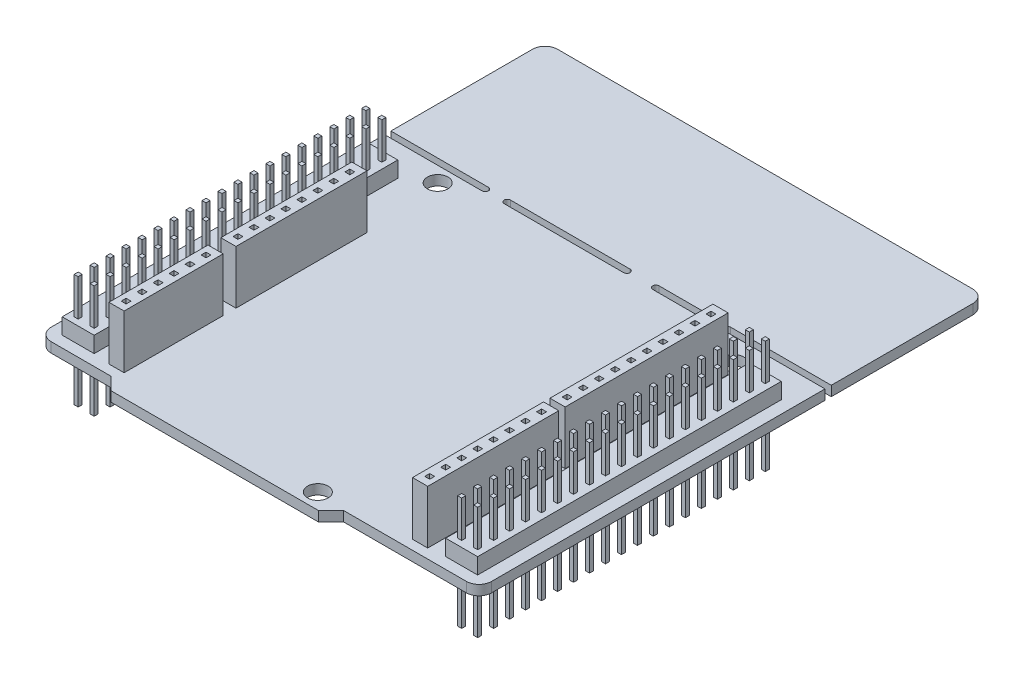
from build123d import *

# Parameters (mm, degrees)
BOSS_EXTRUDE1_DEPTH  = 0.79008
SKETCH2_W            = 5.08
SKETCH2_H            = 48.26
BOSS_EXTRUDE2_DEPTH  = 2.52984
BOSS_EXTRUDE3_START  = -12.109958
SKETCH3_W            = 0.635
SKETCH3_H            = 0.635
BOSS_EXTRUDE3_DEPTH  = 17.951958
LPATTERN1_COUNT      = 2
LPATTERN1_PITCH      = 2.54
LPATTERN1_COUNT_DIR2 = 19
LPATTERN1_PITCH_DIR2 = 2.54
SKETCH4_W            = 2.413
SKETCH4_H            = 15.748
SKETCH4_H_2          = 20.828
SKETCH4_H_3          = 25.908
BOSS_EXTRUDE4_DEPTH  = 8.49884
SKETCH5_W            = 0.7874
SKETCH5_H            = 0.7874
CUT_EXTRUDE1_DEPTH   = 6
LPATTERN2_COUNT      = 18
LPATTERN2_PITCH      = 2.54
LPATTERN2_COUNT_DIR2 = 2
LPATTERN2_PITCH_DIR2 = 48.26
SKETCH7_W            = 0.7874
SKETCH7_H            = 0.7874
CUT_EXTRUDE2_DEPTH   = 6
LPATTERN3_COUNT      = 10
LPATTERN3_PITCH      = 2.54


with BuildPart() as part:
    # Sketch1 → Boss-Extrude1 (new, symmetric)
    with BuildSketch(Plane(origin=(0, 0, 0), x_dir=(1, 0, 0), z_dir=(0, 1, 0))):
        with BuildLine():
            Line((24.110000319, 79.999999702), (-41.889997221, 79.999998432))
            ThreePointArc((-41.889997221, 79.999998432), (-43.304212216, 79.414211366), (-43.889999215, 77.999996344))
            Line((-43.889999215, 77.999996344), (-43.88999858, 55.49999568))
            Line((-43.88999858, 55.49999568), (-28.390001722, 55.49999822))
            ThreePointArc((-28.390001722, 55.49999822), (-27.890003275, 54.999999957), (-28.390001517, 54.50000149))
            Line((-28.390001517, 54.50000149), (-43.88999858, 54.49999768))
            Line((-43.88999858, 54.49999768), (-43.88999858, 1.50000208))
            ThreePointArc((-43.88999858, 1.50000208), (-43.304211826, 0.085787754), (-41.8899975, -0.499999))
            Line((-41.8899975, -0.499999), (-32.39000126, -0.499999))
            Line((-32.39000126, -0.499999), (-30.39000018, -2.50000008))
            Line((-30.39000018, -2.50000008), (2.60999732, -2.50000008))
            Line((2.60999732, -2.50000008), (4.6099984, -0.49999646))
            Line((4.6099984, -0.49999646), (24.109999779, -0.499999))
            ThreePointArc((24.109999779, -0.499999), (25.52421291, 0.085787087), (26.109999215, 1.500000127))
            Line((26.109999215, 1.500000127), (26.110000485, 54.499998315))
            Line((26.110000485, 54.499998315), (10.109999425, 54.499999585))
            ThreePointArc((10.109999425, 54.499999585), (9.756445196, 54.646446567), (9.609998243, 55.000000808))
            ThreePointArc((9.609998243, 55.000000808), (9.756445038, 55.353554628), (10.10999887, 55.500001395))
            Line((10.10999887, 55.500001395), (26.110001438, 55.500000125))
            Line((26.110001438, 55.500000125), (26.110001438, 77.999998622))
            ThreePointArc((26.110001438, 77.999998622), (25.52421467, 79.414212962), (24.110000319, 79.999999702))
        make_face()
        with BuildLine():
            Line((6.06000058, 55.50000076), (-1.27, 55.50000076))
            ThreePointArc((-1.27, 55.50000076), (-1.623553582, 55.353554072), (-1.77000027, 55.00000049))
            ThreePointArc((-1.77000027, 55.00000049), (-1.623553582, 54.646446908), (-1.27, 54.50000022))
            Line((-1.27, 54.50000022), (6.06000058, 54.50000022))
            ThreePointArc((6.06000058, 54.50000022), (6.56000085, 55.00000049), (6.06000058, 55.50000076))
        make_face(mode=Mode.SUBTRACT)
        with BuildLine():
            Line((-5.890001054, 55.5000033), (-24.890001154, 55.49999822))
            ThreePointArc((-24.890001154, 55.49999822), (-25.243554649, 55.353551484), (-25.39000129, 54.99999795))
            ThreePointArc((-25.39000129, 54.99999795), (-25.243554554, 54.646444321), (-24.890000886, 54.49999768))
            Line((-24.890000886, 54.49999768), (-5.890000786, 54.50000276))
            ThreePointArc((-5.890000786, 54.50000276), (-5.39000065, 55.000003164), (-5.890001054, 55.5000033))
        make_face(mode=Mode.SUBTRACT)
        with BuildLine():
            ThreePointArc((1.636, 0), (0, 1.636), (-1.636, 0))
            ThreePointArc((-1.636, 0), (0, -1.636), (1.636, 0))
        make_face(mode=Mode.SUBTRACT)
        with BuildLine():
            ThreePointArc((16.876, 50.8), (15.24, 52.436), (13.604, 50.8))
            ThreePointArc((13.604, 50.8), (15.24, 49.164), (16.876, 50.8))
        make_face(mode=Mode.SUBTRACT)
        with BuildLine():
            ThreePointArc((-31.384, 52.07), (-33.02, 53.706), (-34.656, 52.07))
            ThreePointArc((-34.656, 52.07), (-33.02, 50.434), (-31.384, 52.07))
        make_face(mode=Mode.SUBTRACT)
    extrude(amount=BOSS_EXTRUDE1_DEPTH, both=True)

    # Sketch2 → Boss-Extrude2 (add)
    with BuildSketch(Plane(origin=(0, 0.79008, 0), x_dir=(1, 0, 0), z_dir=(0, 1, 0))):
        with Locations((-39.37006858, 25.400127)):
            Rectangle(SKETCH2_W, SKETCH2_H)
        with Locations((21.58993142, 25.400127)):
            Rectangle(SKETCH2_W, SKETCH2_H)
    extrude(amount=BOSS_EXTRUDE2_DEPTH)

    # Sketch3 → Boss-Extrude3 (add)
    with BuildSketch(Plane(origin=(0, 3.31992, 0), x_dir=(1, 0, 0), z_dir=(0, 1, 0)).offset(BOSS_EXTRUDE3_START)):
        with Locations((-40.64006858, 48.260127)):
            Rectangle(SKETCH3_W, SKETCH3_H)
        with Locations((20.31993142, 48.260127)):
            Rectangle(SKETCH3_W, SKETCH3_H)
    boss_extrude3 = extrude(amount=BOSS_EXTRUDE3_DEPTH)

    # LPattern1: Boss-Extrude3 2 × 19
    with Locations(*[(i * LPATTERN1_PITCH, 0, j * LPATTERN1_PITCH_DIR2) for i in range(LPATTERN1_COUNT) for j in range(LPATTERN1_COUNT_DIR2) if (i, j) != (0, 0)]):
        add(boss_extrude3)

    # Sketch4 → Boss-Extrude4 (add)
    with BuildSketch(Plane(origin=(0, 0.79008, 0), x_dir=(1, 0, 0), z_dir=(0, 1, 0))):
        with Locations((-33.02006858, 8.890127)):
            Rectangle(SKETCH4_W, SKETCH4_H)
        with Locations((-33.02006858, 29.210127)):
            Rectangle(SKETCH4_W, SKETCH4_H_2)
        with Locations((15.23993142, 11.430127)):
            Rectangle(SKETCH4_W, SKETCH4_H_2)
        with Locations((15.23993142, 35.814127)):
            Rectangle(SKETCH4_W, SKETCH4_H_3)
    extrude(amount=BOSS_EXTRUDE4_DEPTH)

    # Sketch5 → Cut-Extrude1 (cut)
    with BuildSketch(Plane(origin=(0, 9.28892, 0), x_dir=(1, 0, 0), z_dir=(0, 1, 0))):
        with Locations((-33.02006858, 2.540127)):
            Rectangle(SKETCH5_W, SKETCH5_H)
    cut_extrude1 = extrude(amount=-CUT_EXTRUDE1_DEPTH, mode=Mode.SUBTRACT)

    # LPattern2: Cut-Extrude1 18 × 2, 14 skipped
    with Locations(*[(j * LPATTERN2_PITCH_DIR2, 0, -i * LPATTERN2_PITCH) for i in range(LPATTERN2_COUNT) for j in range(LPATTERN2_COUNT_DIR2) if (i, j) not in ((0, 0), (6, 0), (8, 1), (9, 1), (10, 1), (11, 1), (12, 1), (13, 1), (14, 1), (15, 0), (15, 1), (16, 0), (16, 1), (17, 0), (17, 1))]):
        add(cut_extrude1, mode=Mode.SUBTRACT)

    # Sketch7 → Cut-Extrude2 (cut)
    with BuildSketch(Plane(origin=(0, 9.28892, 0), x_dir=(1, 0, 0), z_dir=(0, 1, 0))):
        with Locations((15.23993142, 24.384127)):
            Rectangle(SKETCH7_W, SKETCH7_H)
    cut_extrude2 = extrude(amount=-CUT_EXTRUDE2_DEPTH, mode=Mode.SUBTRACT)

    # LPattern3: Cut-Extrude2 ×10
    with Locations(*[(0, 0, -i * LPATTERN3_PITCH) for i in range(1, LPATTERN3_COUNT)]):
        add(cut_extrude2, mode=Mode.SUBTRACT)


solid = part.part
